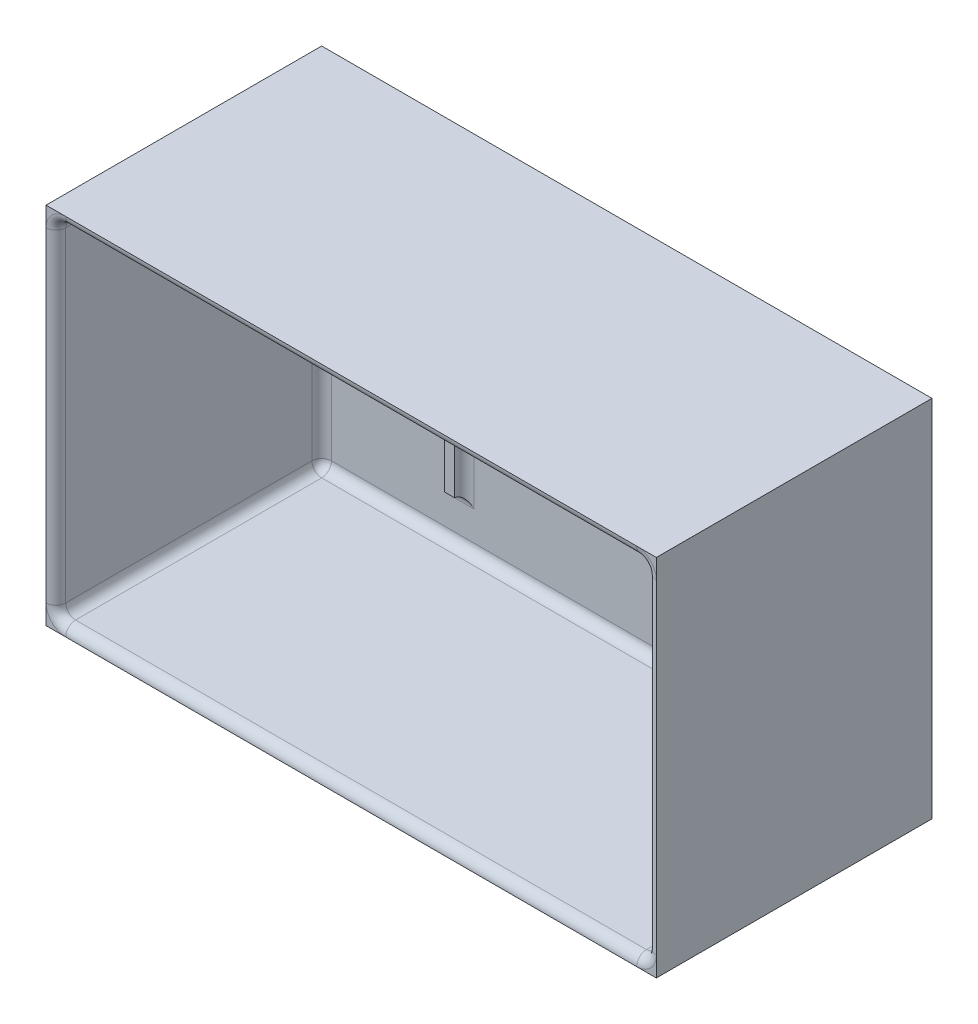
from build123d import *

# Parameters (mm, degrees)
ESQUISSE1_W        = 62
ESQUISSE1_H        = 37
BOSS_EXTRU_1_DEPTH = 28
COQUE1_T           = -1
CONG_1_R           = 1
ESQUISSE2_W        = 1
ESQUISSE2_H        = 25
BOSS_EXTRU_2_DEPTH = 1
CONG_2_R           = 1


with BuildPart() as part:
    # Esquisse1 → Boss.-Extru.1 (new body)
    with BuildSketch(Plane.XY):
        with Locations((31, 18.5)):
            Rectangle(ESQUISSE1_W, ESQUISSE1_H)
    extrude(amount=BOSS_EXTRU_1_DEPTH)

    # Coque1
    coque1_openings = [part.faces().sort_by_distance(p)[0] for p in [
        (31, 18.5, 28),
    ]]
    offset(amount=COQUE1_T, openings=coque1_openings, kind=Kind.INTERSECTION)

    # Congé1
    cong_1_edges = [part.edges().sort_by_distance(p)[0] for p in [
        (1, 18.5, 1),
        (1, 36, 14.5),
        (31, 1, 1),
        (1, 1, 14.5),
        (61, 18.5, 1),
        (61, 1, 14.5),
        (31, 36, 1),
        (61, 36, 14.5),
        (1, 18.5, 28),
        (31, 1, 28),
        (61, 18.5, 28),
        (31, 36, 28),
    ]]
    fillet(cong_1_edges, radius=CONG_1_R - 0.0001)  # a hair under: the kernel refuses the full size

    # Esquisse2 → Boss.-Extru.2 (add)
    with BuildSketch(Plane.XY.offset(1)):
        with Locations((15, 18.5)):
            Rectangle(ESQUISSE2_W, ESQUISSE2_H)
        with Locations((46, 18.5)):
            Rectangle(ESQUISSE2_W, ESQUISSE2_H)
    extrude(amount=BOSS_EXTRU_2_DEPTH)

    # Congé2
    cong_2_edges = [part.edges().sort_by_distance(p)[0] for p in [
        (46, 31, 1),
        (15, 31, 1),
        (46, 6, 1),
        (15, 6, 1),
        (46.5, 18.5, 1),
        (15.5, 18.5, 1),
        (45.5, 18.5, 1),
        (14.5, 18.5, 1),
    ]]
    fillet(cong_2_edges, radius=CONG_2_R - 0.0001)  # a hair under: the kernel refuses the full size


solid = part.part
